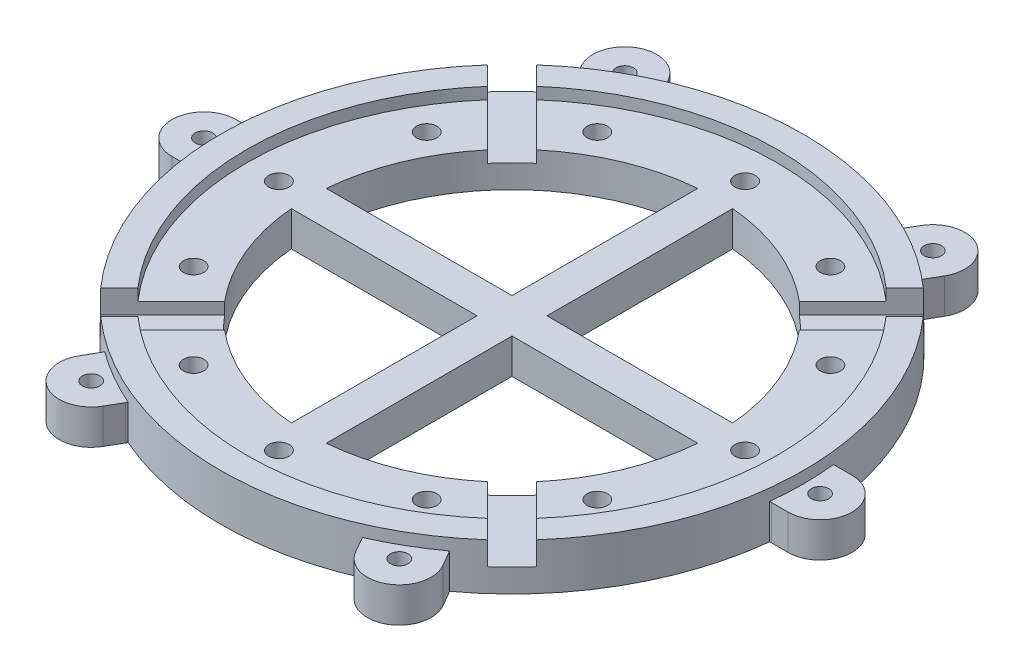
from build123d import *

# Parameters (mm, degrees)
SKETCH1_R           = 50
BOSS_EXTRUDE1_DEPTH = 8
SKETCH2_R           = 45.5
CUT_EXTRUDE1_DEPTH  = 2
SKETCH3_R           = 1.75
CUT_EXTRUDE2_DEPTH  = 72.161787499
SKETCH4_R           = 3.25
CUT_EXTRUDE3_DEPTH  = 3
BOSS_EXTRUDE2_DEPTH = 6
SKETCH6_R           = 1.5
CUT_EXTRUDE4_DEPTH  = 79.087932515
CUT_EXTRUDE6_DEPTH  = 78.908441164
CUT_EXTRUDE9_DEPTH  = 4


with BuildPart() as part:
    # Sketch1 → Boss-Extrude1 (new body)
    with BuildSketch(Plane(origin=(0, 0, 0), x_dir=(1, 0, 0), z_dir=(0, 1, 0))):
        Circle(SKETCH1_R)
    extrude(amount=BOSS_EXTRUDE1_DEPTH)

    # Sketch2 → Cut-Extrude1 (cut)
    with BuildSketch(Plane(origin=(0, 8, 0), x_dir=(1, 0, 0), z_dir=(0, 1, 0))):
        Circle(SKETCH2_R)
    extrude(amount=-CUT_EXTRUDE1_DEPTH, mode=Mode.SUBTRACT)

    # Sketch3 → Cut-Extrude2 (cut, through all)
    with BuildSketch(Plane.XZ):
        with Locations((-40, 0)):
            Circle(SKETCH3_R)
        with Locations((-34.641016151, 20)):
            Circle(SKETCH3_R)
        with Locations((-20, 34.641016151)):
            Circle(SKETCH3_R)
        with Locations((0, 40)):
            Circle(SKETCH3_R)
        with Locations((20, 34.641016151)):
            Circle(SKETCH3_R)
        with Locations((34.641016151, 20)):
            Circle(SKETCH3_R)
        with Locations((40, 0)):
            Circle(SKETCH3_R)
        with Locations((34.641016151, -20)):
            Circle(SKETCH3_R)
        with Locations((20, -34.641016151)):
            Circle(SKETCH3_R)
        with Locations((0, -40)):
            Circle(SKETCH3_R)
        with Locations((-20, -34.641016151)):
            Circle(SKETCH3_R)
        with Locations((-34.641016151, -20)):
            Circle(SKETCH3_R)
    extrude(amount=-CUT_EXTRUDE2_DEPTH, mode=Mode.SUBTRACT)

    # Sketch4 → Cut-Extrude3 (cut)
    with BuildSketch(Plane.XZ):
        with Locations((-40, 0)):
            Circle(SKETCH4_R)
        with Locations((-34.641016151, 20)):
            Circle(SKETCH4_R)
        with Locations((-20, 34.641016151)):
            Circle(SKETCH4_R)
        with Locations((0, 40)):
            Circle(SKETCH4_R)
        with Locations((20, 34.641016151)):
            Circle(SKETCH4_R)
        with Locations((34.641016151, 20)):
            Circle(SKETCH4_R)
        with Locations((40, 0)):
            Circle(SKETCH4_R)
        with Locations((34.641016151, -20)):
            Circle(SKETCH4_R)
        with Locations((20, -34.641016151)):
            Circle(SKETCH4_R)
        with Locations((0, -40)):
            Circle(SKETCH4_R)
        with Locations((-20, -34.641016151)):
            Circle(SKETCH4_R)
        with Locations((-34.641016151, -20)):
            Circle(SKETCH4_R)
    extrude(amount=-CUT_EXTRUDE3_DEPTH, mode=Mode.SUBTRACT)

    # Sketch5 → Boss-Extrude2 (add)
    with BuildSketch(Plane.XZ):
        with BuildLine():
            Line((50, 5.481362668), (52.872058145, 5.481362668))
            ThreePointArc((52.872058145, 5.481362668), (58.353420813, 0), (52.872058145, -5.481362668))
            Line((52.872058145, -5.481362668), (50, -5.481362668))
            ThreePointArc((50, -5.481362668), (49.849716822, -5.479302115), (49.699546633, -5.473122004))
            ThreePointArc((49.699546633, -5.473122004), (50, 0), (49.699546633, 5.473122004))
            ThreePointArc((49.699546633, 5.473122004), (49.849716822, 5.479302115), (50, 5.481362668))
        make_face()
        with BuildLine():
            Line((29.746999318, -40.560588855), (31.18302839, -43.04786417))
            ThreePointArc((31.18302839, -43.04786417), (29.176710406, -50.535544822), (21.689029755, -48.529226838))
            Line((21.689029755, -48.529226838), (20.253000682, -46.041951523))
            ThreePointArc((20.253000682, -46.041951523), (20.179643585, -45.910772197), (20.109910623, -45.777630943))
            ThreePointArc((20.109910623, -45.777630943), (25, -43.301270189), (29.58963601, -40.304508939))
            ThreePointArc((29.58963601, -40.304508939), (29.670073237, -40.431470082), (29.746999318, -40.560588855))
        make_face()
        with BuildLine():
            Line((-20.253000682, -46.041951523), (-21.689029755, -48.529226838))
            ThreePointArc((-21.689029755, -48.529226838), (-29.176710406, -50.535544822), (-31.18302839, -43.04786417))
            Line((-31.18302839, -43.04786417), (-29.746999318, -40.560588855))
            ThreePointArc((-29.746999318, -40.560588855), (-29.670073237, -40.431470082), (-29.58963601, -40.304508939))
            ThreePointArc((-29.58963601, -40.304508939), (-25, -43.301270189), (-20.109910623, -45.777630943))
            ThreePointArc((-20.109910623, -45.777630943), (-20.179643585, -45.910772197), (-20.253000682, -46.041951523))
        make_face()
        with BuildLine():
            Line((-50, -5.481362668), (-52.872058145, -5.481362668))
            ThreePointArc((-52.872058145, -5.481362668), (-58.353420813, 0), (-52.872058145, 5.481362668))
            Line((-52.872058145, 5.481362668), (-50, 5.481362668))
            ThreePointArc((-50, 5.481362668), (-49.849716822, 5.479302115), (-49.699546633, 5.473122004))
            ThreePointArc((-49.699546633, 5.473122004), (-50, 0), (-49.699546633, -5.473122004))
            ThreePointArc((-49.699546633, -5.473122004), (-49.849716822, -5.479302115), (-50, -5.481362668))
        make_face()
        with BuildLine():
            Line((-29.746999318, 40.560588855), (-31.18302839, 43.04786417))
            ThreePointArc((-31.18302839, 43.04786417), (-29.176710406, 50.535544822), (-21.689029755, 48.529226838))
            Line((-21.689029755, 48.529226838), (-20.253000682, 46.041951523))
            ThreePointArc((-20.253000682, 46.041951523), (-20.179643585, 45.910772197), (-20.109910623, 45.777630943))
            ThreePointArc((-20.109910623, 45.777630943), (-25, 43.301270189), (-29.58963601, 40.304508939))
            ThreePointArc((-29.58963601, 40.304508939), (-29.670073237, 40.431470082), (-29.746999318, 40.560588855))
        make_face()
        with BuildLine():
            Line((20.253000682, 46.041951523), (21.689029755, 48.529226838))
            ThreePointArc((21.689029755, 48.529226838), (29.176710406, 50.535544822), (31.18302839, 43.04786417))
            Line((31.18302839, 43.04786417), (29.746999318, 40.560588855))
            ThreePointArc((29.746999318, 40.560588855), (29.670073237, 40.431470082), (29.58963601, 40.304508939))
            ThreePointArc((29.58963601, 40.304508939), (25, 43.301270189), (20.109910623, 45.777630943))
            ThreePointArc((20.109910623, 45.777630943), (20.179643585, 45.910772197), (20.253000682, 46.041951523))
        make_face()
    extrude(amount=-BOSS_EXTRUDE2_DEPTH)

    # Sketch6 → Cut-Extrude4 (cut, through all)
    with BuildSketch(Plane.XZ):
        with Locations((52.872058145, 0)):
            Circle(SKETCH6_R)
        with Locations((26.436029072, -45.788545504)):
            Circle(SKETCH6_R)
        with Locations((-26.436029072, -45.788545504)):
            Circle(SKETCH6_R)
        with Locations((-52.872058145, 0)):
            Circle(SKETCH6_R)
        with Locations((-26.436029072, 45.788545504)):
            Circle(SKETCH6_R)
        with Locations((26.436029072, 45.788545504)):
            Circle(SKETCH6_R)
    extrude(amount=-CUT_EXTRUDE4_DEPTH, mode=Mode.SUBTRACT)

    # Sketch9 → Cut-Extrude6 (cut, through all)
    with BuildSketch(Plane(origin=(0, 6, 0), x_dir=(1, 0, 0), z_dir=(0, 1, 0))):
        with BuildLine():
            Line((-3, -3), (-3, -34.871191548))
            ThreePointArc((-3, -34.871191548), (-24.748737342, -24.748737342), (-34.871191548, -3))
            Line((-34.871191548, -3), (-3, -3))
        make_face()
        with BuildLine():
            Line((-3, 3), (-34.871191548, 3))
            ThreePointArc((-34.871191548, 3), (-24.748737342, 24.748737342), (-3, 34.871191548))
            Line((-3, 34.871191548), (-3, 3))
        make_face()
        with BuildLine():
            Line((3, 3), (3, 34.871191548))
            ThreePointArc((3, 34.871191548), (24.748737342, 24.748737342), (34.871191548, 3))
            Line((34.871191548, 3), (3, 3))
        make_face()
        with BuildLine():
            Line((3, -3), (34.871191548, -3))
            ThreePointArc((34.871191548, -3), (24.748737342, -24.748737342), (3, -34.871191548))
            Line((3, -34.871191548), (3, -3))
        make_face()
    extrude(amount=-CUT_EXTRUDE6_DEPTH, mode=Mode.SUBTRACT)

    # Sketch10 → Cut-Extrude9 (cut)
    with BuildSketch(Plane(origin=(0, 8, 0), x_dir=(1, 0, 0), z_dir=(0, 1, 0))):
        with BuildLine():
            Line((-24.054791846, 19.812151159), (-37.476659403, 33.234018716))
            ThreePointArc((-37.476659403, 33.234018716), (-37.476659403, 37.476659403), (-33.234018716, 37.476659403))
            Line((-33.234018716, 37.476659403), (-19.812151159, 24.054791846))
            ThreePointArc((-19.812151159, 24.054791846), (-22.035815668, 22.035815668), (-24.054791846, 19.812151159))
        make_face()
        with BuildLine():
            Line((19.812151159, 24.054791846), (33.234018716, 37.476659403))
            ThreePointArc((33.234018716, 37.476659403), (37.476659403, 37.476659403), (37.476659403, 33.234018716))
            Line((37.476659403, 33.234018716), (24.054791846, 19.812151159))
            ThreePointArc((24.054791846, 19.812151159), (22.035815668, 22.035815668), (19.812151159, 24.054791846))
        make_face()
        with BuildLine():
            Line((24.054791846, -19.812151159), (37.476659403, -33.234018716))
            ThreePointArc((37.476659403, -33.234018716), (37.476659403, -37.476659403), (33.234018716, -37.476659403))
            Line((33.234018716, -37.476659403), (19.812151159, -24.054791846))
            ThreePointArc((19.812151159, -24.054791846), (22.035815668, -22.035815668), (24.054791846, -19.812151159))
        make_face()
        with BuildLine():
            Line((-19.812151159, -24.054791846), (-33.234018716, -37.476659403))
            ThreePointArc((-33.234018716, -37.476659403), (-37.476659403, -37.476659403), (-37.476659403, -33.234018716))
            Line((-37.476659403, -33.234018716), (-24.054791846, -19.812151159))
            ThreePointArc((-24.054791846, -19.812151159), (-22.035815668, -22.035815668), (-19.812151159, -24.054791846))
        make_face()
    extrude(amount=-CUT_EXTRUDE9_DEPTH, mode=Mode.SUBTRACT)


solid = part.part
